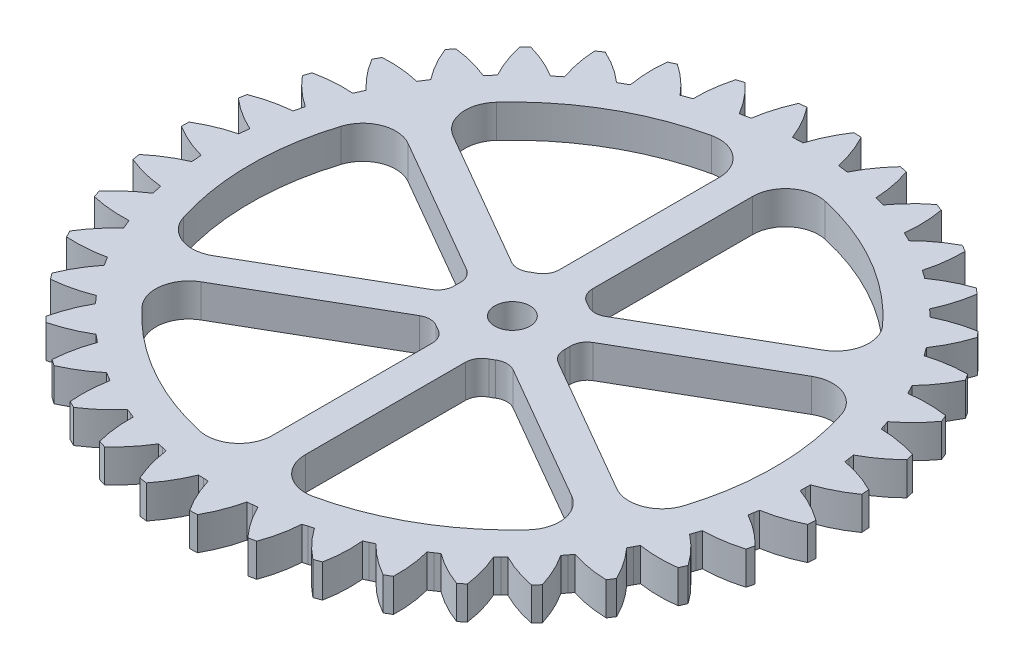
from build123d import *

# Parameters (mm, degrees)
BOSS_EXTRUDE1_DEPTH      = 1.5
CIRPATTERN2_COUNT        = 39
SKETCH3_R                = 1.6
CUT_EXTRUDE1_DEPTH       = 43.388110201
CUT_EXTRUDE2_DEPTH       = 43.388110201
FILLET1_R                = 3
FILLET2_R                = 1.5
CIRPATTERN1_COUNT        = 6
FILLET1_OF_CIRPATTERN1_R = 3
FILLET2_OF_CIRPATTERN1_R = 1.5


with BuildPart() as part:
    # Sketch5 → Boss-Extrude1 (new, symmetric)
    with BuildSketch(Plane(origin=(0, 0, 0), x_dir=(1, 0, 0), z_dir=(0, 1, 0))):
        with BuildLine():
            Line((0, 0), (26.449954509, 4.090817025))
            Line((26.449954509, 4.090817025), (26.520897753, 3.638243521))
            ThreePointArc((26.520897753, 3.638243521), (28.197939687, 3.197253599), (29.794725899, 2.521076439))
            Line((29.794725899, 2.521076439), (29.819813733, 2.177516055))
            Line((29.819813733, 2.177516055), (29.844901148, 1.833955641))
            ThreePointArc((29.844901148, 1.833955641), (28.363282087, 0.932985765), (26.768092937, 0.253049491))
            Line((26.768092937, 0.253049491), (26.763647744, -0.205029062))
            Line((26.763647744, -0.205029062), (0, 0))
        make_face()
    boss_extrude1 = extrude(amount=BOSS_EXTRUDE1_DEPTH, both=True)

    # CirPattern2: Boss-Extrude1 ×39 about axis
    cirpattern2_axis = Axis((0, 0, 0), (0, 1, 0))
    for i in range(1, CIRPATTERN2_COUNT):
        add(boss_extrude1.rotate(cirpattern2_axis, i * 360 / CIRPATTERN2_COUNT))

    # Sketch3 → Cut-Extrude1 (cut, through all)
    with BuildSketch(Plane(origin=(0, 1.5, 0), x_dir=(1, 0, 0), z_dir=(0, 1, 0))):
        with Locations(Location((0, 0, 0), (0, 0, 270))):
            Circle(SKETCH3_R)
    extrude(amount=-CUT_EXTRUDE1_DEPTH, mode=Mode.SUBTRACT)

    # Sketch4 → Cut-Extrude2 (cut, through all)
    with BuildSketch(Plane(origin=(0, 1.5, 0), x_dir=(1, 0, 0), z_dir=(0, 1, 0))):
        with BuildLine():
            Line((4.88067791, 1.085809898), (21.289565422, 10.55948552))
            ThreePointArc((21.289565422, 10.55948552), (23.764434147, 0), (21.289565422, -10.55948552))
            Line((21.289565422, -10.55948552), (4.88067791, -1.085809898))
            ThreePointArc((4.88067791, -1.085809898), (5, 0), (4.88067791, 1.085809898))
        make_face()
    cut_extrude2 = extrude(amount=-CUT_EXTRUDE2_DEPTH, mode=Mode.SUBTRACT)

    # Fillet1
    fillet1_edges = [part.edges().sort_by_distance(p)[0] for p in [
        (21.289565422, 0, -10.55948552),
        (21.289565422, 0, 10.55948552),
    ]]
    fillet(fillet1_edges, radius=FILLET1_R)

    # Fillet2
    fillet2_edges = [part.edges().sort_by_distance(p)[0] for p in [
        (4.88067791, 0, 1.085809898),
        (4.88067791, 0, -1.085809898),
    ]]
    fillet(fillet2_edges, radius=FILLET2_R)

    # CirPattern1: Cut-Extrude2 ×6 about axis
    cirpattern1_axis = Axis((0, 0, 0), (0, 1, 0))
    for i in range(1, CIRPATTERN1_COUNT):
        add(cut_extrude2.rotate(cirpattern1_axis, i * 360 / CIRPATTERN1_COUNT), mode=Mode.SUBTRACT)

    # Fillet1 of CirPattern1
    fillet1_of_cirpattern1_edges = [part.edges().sort_by_distance(p)[0] for p in [
        (1.5, 0, -23.717047251),
        (19.789565422, 0, -13.157561731),
        (-19.789565422, 0, -13.157561731),
        (-1.5, 0, -23.717047251),
        (-21.289565422, 0, 10.55948552),
        (-21.289565422, 0, -10.55948552),
        (-1.5, 0, 23.717047251),
        (-19.789565422, 0, 13.157561731),
        (19.789565422, 0, 13.157561731),
        (1.5, 0, 23.717047251),
    ]]
    fillet(fillet1_of_cirpattern1_edges, radius=FILLET1_OF_CIRPATTERN1_R)

    # Fillet2 of CirPattern1
    fillet2_of_cirpattern1_edges = [part.edges().sort_by_distance(p)[0] for p in [
        (3.38067791, 0, -3.683886109),
        (1.5, 0, -4.769696007),
        (-1.5, 0, -4.769696007),
        (-3.38067791, 0, -3.683886109),
        (-4.88067791, 0, -1.085809898),
        (-4.88067791, 0, 1.085809898),
        (-3.38067791, 0, 3.683886109),
        (-1.5, 0, 4.769696007),
        (1.5, 0, 4.769696007),
        (3.38067791, 0, 3.683886109),
    ]]
    fillet(fillet2_of_cirpattern1_edges, radius=FILLET2_OF_CIRPATTERN1_R)


solid = part.part
